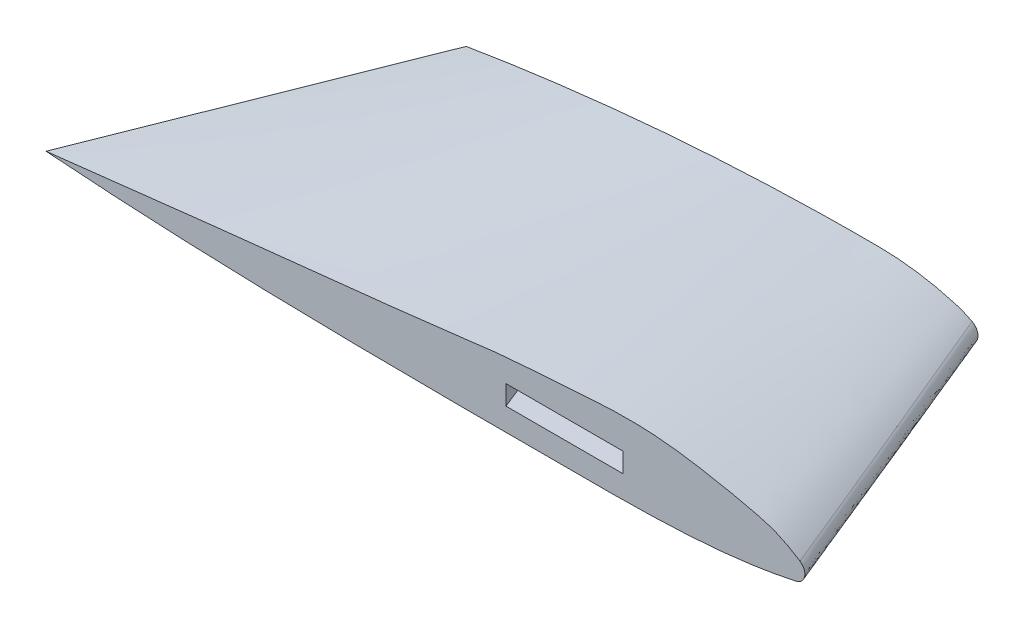
from build123d import *

# Parameters (mm, degrees)
FILLET1_R          = 6.35
CUT_EXTRUDE2_DEPTH = 5.715


with BuildPart() as part:
    # Loft1: read off the stored shape, not the designer's step
    # Loft1: loft between two sections, ruled curve by curve
    loft1_from = [
        Edge.make_bspline([(175.269753602, 13.29140622, 0), (165.836250903, 10.800407431, 0), (146.733604162, 6.768636817, 0), (117.705631888, 3.120825545, 0), (88.515569293, 1.298481639, 0), (69.014979931, 0.896470859, 0), (55.76421182, 0.761993128, 0), (48.774937515, 0.717177079, 0), (38.290373313, 0.701329652, 0), (27.805353703, 0.707699483, 0), (17.319910015, 0.713085206, 0), (6.83407663, 0.722118469, 0), (-7.147508406, 0.739950104, 0), (-24.625279721, 0.778748607, 0), (-45.599536509, 0.865679132, 0), (-66.57427479, 1.007789933, 0), (-87.548981294, 1.219546921, 0), (-115.514221109, 1.6142682, 0), (-150.466857604, 2.354791987, 0), (-192.394333089, 3.75520411, 0), (-234.292384281, 5.782786145, 0), (-262.192310795, 7.628406717, 0), (-276.130119323, 8.693130358, 0)], [0, 0, 0, 0, 0.0646771, 0.1293542, 0.1940313, 0.2587084, 0.2587084, 0.281873762, 0.305039125, 0.328204487, 0.35136985, 0.374535212, 0.397700575, 0.4440313, 0.490362025, 0.53669275, 0.583023475, 0.6293542, 0.72201565, 0.8146771, 0.90733855, 1, 1, 1, 1], 3),
        Edge.make_bspline([(-276.130119323, 8.693130358, 0), (-268.53787532, 9.576768707, 0), (-253.325399224, 11.344499336, 0), (-230.431819466, 13.984673016, 0), (-207.472747934, 16.599459007, 0), (-188.293872161, 18.747068462, 0), (-172.928345638, 20.442413166, 0), (-161.394414944, 21.702112718, 0), (-149.852162971, 22.949878112, 0), (-138.303049105, 24.185400988, 0), (-126.749160881, 25.414250719, 0), (-115.192581437, 26.642009102, 0), (-103.635319012, 27.873545783, 0), (-92.079421128, 29.114032776, 0), (-82.4523943, 30.15987089, 0), (-74.753639148, 31.007237325, 0), (-68.981311413, 31.649138297, 0), (-63.211054502, 32.298649993, 0), (-57.443210697, 32.957070927, 0), (-51.678207111, 33.626346988, 0), (-45.916440626, 34.308134914, 0), (-40.158566872, 35.006057107, 0), (-34.405025776, 35.721868628, 0), (-28.65726222, 36.464938228, 0), (-22.912163066, 37.208891257, 0), (-17.164494437, 37.912252593, 0), (-11.409460822, 38.52679641, 0), (-5.649439363, 39.060124365, 0), (0.112709129, 39.531603667, 0), (5.875152486, 39.955359252, 0), (11.636225955, 40.347755751, 0), (17.394685212, 40.723251, 0), (23.149306668, 41.097541248, 0), (28.899044879, 41.484229227, 0), (34.642434767, 41.900999198, 0), (40.378877605, 42.351270671, 0), (46.114635135, 42.749637865, 0), (51.851500917, 43.055266027, 0), (59.500067158, 43.326067455, 0), (69.055892317, 43.378352696, 0), (80.491984345, 42.872950191, 0), (88.069711352, 42.111461167, 0), (96.99345827, 41.022920564, 0), (106.798051302, 39.527027067, 0), (120.757492461, 36.908252937, 0), (134.380844207, 33.958325891, 0), (143.515206323, 31.743252941, 0), (149.29638768, 29.715848138, 0), (151.784819047, 28.759100363, 0), (156.573051684, 26.578927821, 0), (162.27208079, 23.407349715, 0), (168.873329947, 18.939330848, 0), (173.160310936, 15.339346478, 0), (175.269753602, 13.29140622, 0)], [0, 0, 0, 0, 0.049341751, 0.098683502, 0.148025253, 0.197367004, 0.22203788, 0.246708755, 0.271379631, 0.296050506, 0.320721382, 0.345392257, 0.370063133, 0.394734008, 0.419404884, 0.431740322, 0.444075759, 0.456411197, 0.468746635, 0.481082073, 0.49341751, 0.505752948, 0.518088386, 0.530423824, 0.542759261, 0.555094699, 0.567430137, 0.579765575, 0.592101012, 0.60443645, 0.616771888, 0.629107326, 0.641442763, 0.653778201, 0.666113639, 0.678449077, 0.690784514, 0.703119952, 0.71545539, 0.740126266, 0.764797141, 0.789468017, 0.789468017, 0.823121948, 0.856775879, 0.89042981, 0.924083742, 0.924083742, 0.933573274, 0.943062806, 0.962041871, 0.981020935, 1, 1, 1, 1], 3),
    ]
    loft1_to = [
        Edge.make_bspline([(105.998873038, 13.291406071, -171.45), (99.547178972, 11.655691815, -171.45), (86.528720121, 8.807386477, -171.45), (66.752163818, 5.81997153, -171.45), (46.823097819, 4.126992417, -171.45), (33.499454727, 3.863700867, -171.45), (24.460450661, 3.97819944, -171.45), (19.693183294, 4.042786303, -171.45), (12.542798034, 4.152256247, -171.45), (5.392928427, 4.274314749, -171.45), (-1.75642567, 4.408960717, -171.45), (-8.905264395, 4.556193059, -171.45), (-18.436362387, 4.769283228, -171.45), (-30.34894715, 5.067106419, -171.45), (-44.641989626, 5.474822285, -171.45), (-58.932973358, 5.932868481, -171.45), (-73.221898844, 6.441247299, -171.45), (-92.271055825, 7.186198942, -171.45), (-116.077358919, 8.24323151, -171.45), (-144.636691691, 9.71312147, -171.45), (-173.187791596, 11.38456436, -171.45), (-192.216363366, 12.633355108, -171.45), (-201.72927398, 13.291406071, -171.45)], [0, 0, 0, 0, 0.0646771, 0.1293542, 0.1940313, 0.2587084, 0.2587084, 0.281873762, 0.305039125, 0.328204487, 0.35136985, 0.374535212, 0.397700575, 0.4440313, 0.490362025, 0.53669275, 0.583023475, 0.6293542, 0.72201565, 0.8146771, 0.90733855, 1, 1, 1, 1], 3),
        Edge.make_bspline([(-201.72927398, 13.291406071, -171.45), (-196.706001762, 14.118734782, -171.45), (-186.669871897, 15.717039915, -171.45), (-171.640734103, 17.947797667, -171.45), (-156.630466607, 20.014212394, -171.45), (-144.132480019, 21.601236244, -171.45), (-134.13733919, 22.791040732, -171.45), (-126.641873709, 23.64360893, -171.45), (-119.146564288, 24.456514085, -171.45), (-111.650676847, 25.229878327, -171.45), (-104.153477306, 25.963823782, -171.45), (-96.654231583, 26.658472577, -171.45), (-89.152205599, 27.313946841, -171.45), (-81.646665274, 27.9303687, -171.45), (-75.388507985, 28.411611685, -171.45), (-70.379479761, 28.777128777, -171.45), (-66.621362852, 29.041524908, -171.45), (-62.861805656, 29.296176313, -171.45), (-59.100713628, 29.541079951, -171.45), (-55.337992223, 29.776232783, -171.45), (-51.573546895, 30.001631769, -171.45), (-47.8072831, 30.217273872, -171.45), (-44.039106291, 30.42315605, -171.45), (-40.268921924, 30.619275264, -171.45), (-36.496635452, 30.805628475, -171.45), (-32.722152332, 30.982212644, -171.45), (-28.945378018, 31.149024731, -171.45), (-25.166217963, 31.306061697, -171.45), (-21.384577624, 31.453320502, -171.45), (-17.600362454, 31.590798107, -171.45), (-13.813466378, 31.718470556, -171.45), (-10.023783319, 31.836313894, -171.45), (-6.231207201, 31.944304163, -171.45), (-2.435631947, 32.042417409, -171.45), (1.363048518, 32.130629675, -171.45), (5.164940272, 32.208917006, -171.45), (8.970149389, 32.277255445, -171.45), (12.778781947, 32.335621037, -171.45), (17.861664714, 32.400112757, -171.45), (24.224357154, 32.455675508, -171.45), (31.874979066, 32.482076127, -171.45), (36.986220068, 32.472698987, -171.45), (43.034735977, 32.445594637, -171.45), (50.252197512, 32.186193716, -171.45), (61.575304209, 30.990235835, -171.45), (73.03796941, 28.932962432, -171.45), (80.486980807, 27.023727732, -171.45), (85.121527508, 25.659816178, -171.45), (87.166401389, 24.993278477, -171.45), (91.228193462, 23.397991092, -171.45), (96.154779045, 20.919674072, -171.45), (101.516443745, 17.32147055, -171.45), (104.593880705, 14.655434782, -171.45), (105.998873038, 13.291406071, -171.45)], [0, 0, 0, 0, 0.049341751, 0.098683502, 0.148025253, 0.197367004, 0.22203788, 0.246708755, 0.271379631, 0.296050506, 0.320721382, 0.345392257, 0.370063133, 0.394734008, 0.419404884, 0.431740322, 0.444075759, 0.456411197, 0.468746635, 0.481082073, 0.49341751, 0.505752948, 0.518088386, 0.530423824, 0.542759261, 0.555094699, 0.567430137, 0.579765575, 0.592101012, 0.60443645, 0.616771888, 0.629107326, 0.641442763, 0.653778201, 0.666113639, 0.678449077, 0.690784514, 0.703119952, 0.71545539, 0.740126266, 0.764797141, 0.789468017, 0.789468017, 0.823121948, 0.856775879, 0.89042981, 0.924083742, 0.924083742, 0.933573274, 0.943062806, 0.962041871, 0.981020935, 1, 1, 1, 1], 3),
    ]
    loft1 = Solid(Shell([*[Face.make_surface_from_curves(loft1_from[k], loft1_to[k]) for k in range(2)], Face(Wire(loft1_from)), Face(Wire(loft1_to))]))
    add(loft1)

    # Fillet1
    fillet1_edges = [part.edges().sort_by_distance(p)[0] for p in [
        (140.63431332, 13.291406146, -85.725),
    ]]
    fillet(fillet1_edges, radius=FILLET1_R)

    # Sketch9 → Cut-Extrude2 (cut, symmetric)
    with BuildSketch(Plane(origin=(0, 19.812, 0), x_dir=(1, 0, 0), z_dir=(0, 1, 0))):
        Polygon((-7.80027398, 171.45), (-76.28723014, 171.45), (-7.016933721, 0), (61.470022439, 0), align=None)
    extrude(amount=CUT_EXTRUDE2_DEPTH, both=True, mode=Mode.SUBTRACT)


solid = part.part
